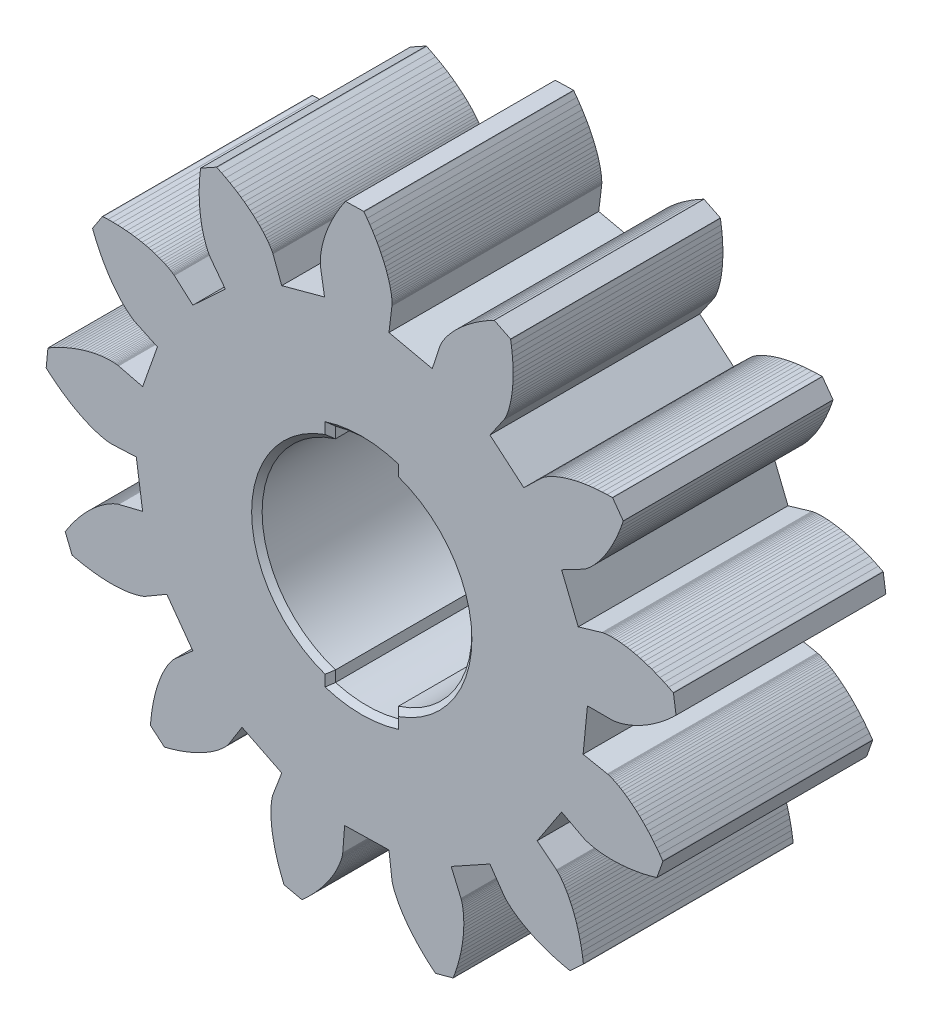
from build123d import *

# Parameters (mm, degrees)
BOSS_EXTRUDE1_DEPTH = 5
CHAMFER1_SIZE       = 0.25


with BuildPart() as part:
    # Model → Boss-Extrude1 (new, symmetric)
    with BuildSketch(Plane.XY):
        Polygon((10.551307782, -2.104276688), (10.759088916, 0), (11.943493667, 2.011e-05), (11.953388007, 0.000341878), (11.971869507, 0.001437897), (11.998887892, 0.003740543), (12.034392886, 0.007732467), (12.078304046, 0.013866153), (12.130530876, 0.022594087), (12.190952712, 0.034358698), (12.259448893, 0.049602416), (12.335858535, 0.068787783), (12.420010699, 0.09232706), (12.511734446, 0.120662679), (12.610808561, 0.154196849), (12.717041995, 0.193371999), (12.830163257, 0.238570228), (12.949951132, 0.290193744), (13.076114018, 0.348634702), (13.208380425, 0.414275199), (13.346438641, 0.48746717), (13.489987009, 0.568572601), (13.638673595, 0.65793337), (13.792176634, 0.755891355), (13.950124081, 0.862758268), (14.112143894, 0.978845821), (14.277843919, 1.10443556), (14.446832001, 1.239809031), (14.618705933, 1.385237726), (14.793033339, 1.540962969), (14.969381845, 1.707205975), (14.980452646, 1.717955009), (14.98425352, 1.721655331), (14.85881461, 2.583277359), (14.855395834, 2.585077244), (14.841730785, 2.592246618), (14.625593761, 2.701898828), (14.414373741, 2.802008631), (14.208412602, 2.892948071), (14.008052223, 2.975048969), (13.81361437, 3.04870348), (13.625400701, 3.114273591), (13.443692761, 3.172151456), (13.268772096, 3.222749339), (13.100890088, 3.266459395), (12.940278007, 3.303693887), (12.787157067, 3.334895245), (12.641738427, 3.360475733), (12.504203083, 3.380887836), (12.374711918, 3.396563929), (12.253415759, 3.407956497), (12.140455381, 3.41550797), (12.035931335, 3.419690943), (11.939944173, 3.420947846), (11.852564283, 3.419751274), (11.773851995, 3.416553713), (11.703847531, 3.411837813), (11.642560945, 3.406046005), (11.590002293, 3.399660938), (11.546141409, 3.393125043), (11.510958182, 3.386931025), (11.484382227, 3.38151126), (11.466353212, 3.377328287), (11.456760529, 3.374844647), (10.32062085, 3.040186705), (9.52670064, 5), (10.575430263, 5.550432978), (10.584037534, 5.555319816), (10.599894621, 5.564872279), (10.622750144, 5.579472463), (10.652332611, 5.599512523), (10.688370531, 5.625344391), (10.730552193, 5.657340112), (10.778585994, 5.695841562), (10.832150169, 5.741170508), (10.890892783, 5.793668829), (10.954461905, 5.85361807), (11.022515656, 5.921329944), (11.094661883, 5.997075941), (11.170518488, 6.081117497), (11.24968326, 6.173716049), (11.331753993, 6.27509281), (11.416308366, 6.385479051), (11.502914004, 6.505055766), (11.591148588, 6.63402406), (11.680559634, 6.772554871), (11.770694655, 6.920788973), (11.861081057, 7.078857083), (11.95127641, 7.246879864), (12.040788008, 7.424957869), (12.129143255, 7.613171538), (12.215869556, 7.811581204), (12.300474204, 8.020217032), (12.382464495, 8.239119243), (12.461347722, 8.468277782), (12.466164174, 8.482938297), (12.467803175, 8.487986019), (11.956324132, 9.192615846), (11.952462926, 9.192615846), (11.937028159, 9.192625901), (11.694687222, 9.189267457), (11.461134551, 9.179755216), (11.236510918, 9.164561773), (11.020936986, 9.14414967), (10.814543473, 9.119001557), (10.617420875, 9.089590028), (10.429629525, 9.056397736), (10.251229754, 9.019907331), (10.082261782, 8.980591408), (9.922735664, 8.938922563), (9.772661457, 8.895393501), (9.632008993, 8.850466763), (9.500738053, 8.804614945), (9.378798361, 8.758320697), (9.266109473, 8.71204656), (9.162570839, 8.666234962), (9.068081906, 8.621358501), (8.9825019, 8.57786966), (8.90569005, 8.536200815), (8.837475415, 8.496794395), (8.777677002, 8.460082775), (8.726103762, 8.426468163), (8.682534479, 8.396382935), (8.646737884, 8.370229299), (8.618462597, 8.348379299), (8.59744718, 8.331235143), (8.583430199, 8.31915882), (8.576089886, 8.312502262), (7.725609045, 7.488185113), (6.111856315, 8.854559239), (6.78466136, 9.829312585), (6.790010739, 9.83763831), (6.799613477, 9.853465231), (6.813067366, 9.877014564), (6.829950086, 9.908507523), (6.849849373, 9.948125103), (6.872332852, 9.996068408), (6.896978204, 10.05247821), (6.923332945, 10.117505339), (6.950954643, 10.191280513), (6.979390814, 10.273914338), (7.008168863, 10.365497311), (7.036856415, 10.466089765), (7.064960765, 10.575762085), (7.092029426, 10.694544438), (7.117579748, 10.822446878), (7.141159247, 10.959479461), (7.162275215, 11.105612021), (7.180465114, 11.260814393), (7.195256348, 11.425026244), (7.20617632, 11.598167134), (7.212762492, 11.78013651), (7.214532211, 11.970833819), (7.211032993, 12.170108234), (7.201802298, 12.377829037), (7.186397696, 12.593805178), (7.164346591, 12.817865719), (7.13521661, 13.049789444), (7.098565321, 13.289365194), (7.096021349, 13.304588802), (7.095126434, 13.309807463), (6.314780776, 13.696028589), (6.311351945, 13.694238759), (6.297686896, 13.687069385), (6.084666991, 13.571484593), (5.882285512, 13.454522236), (5.690451962, 13.336675019), (5.509065789, 13.218425593), (5.337996276, 13.100246554), (5.177112703, 12.982590386), (5.026254188, 12.865929686), (4.885249792, 12.750716937), (4.753908465, 12.637374461), (4.632029104, 12.52635474), (4.519370382, 12.418059985), (4.41570103, 12.312912516), (4.320779722, 12.211314539), (4.234314857, 12.113658211), (4.156044999, 12.020305518), (4.085658436, 11.931628504), (4.022843456, 11.847979101), (3.967278292, 11.769699188), (3.918621067, 11.697110531), (3.876539957, 11.630514787), (3.840652866, 11.570223668), (3.810607858, 11.51649861), (3.786002727, 11.469611104), (3.766465428, 11.429802475), (3.751583698, 11.397324104), (3.740945271, 11.372377095), (3.734137885, 11.355162553), (3.73073922, 11.345861471), (3.360757279, 10.220732262), (1.296862368, 10.680638064), (1.439606318, 11.856415434), (1.440481122, 11.866279608), (1.441627418, 11.884751053), (1.442592719, 11.91184988), (1.442904431, 11.947586143), (1.442110068, 11.991919623), (1.439747091, 12.044810097), (1.435352958, 12.10620729), (1.42846513, 12.176040816), (1.418641177, 12.254200067), (1.405408504, 12.34058449), (1.38834479, 12.435053313), (1.366987495, 12.537455707), (1.340914301, 12.647620733), (1.309672723, 12.765377453), (1.27286055, 12.890504652), (1.230055465, 13.022801224), (1.180845202, 13.162015791), (1.124827553, 13.307886915), (1.061610364, 13.460163216), (0.990821592, 13.618543038), (0.912079139, 13.782724724), (0.825031071, 13.952406617), (0.729325455, 14.127236784), (0.624620415, 14.306863293), (0.510604238, 14.490944266), (0.386955158, 14.679087549), (0.253381572, 14.870911043), (0.109591879, 15.066012541), (0.100260631, 15.078310079), (0.09704296, 15.082523218), (-0.773407554, 15.061859734), (-0.775599593, 15.058682283), (-0.784377803, 15.045982536), (-0.919278679, 14.844636745), (-1.044124331, 14.647021442), (-1.159216417, 14.45352878), (-1.264876703, 14.264520748), (-1.361426957, 14.080379444), (-1.449209056, 13.90143669), (-1.528564878, 13.728034365), (-1.599876522, 13.560484179), (-1.663505975, 13.399097845), (-1.719835336, 13.244146855), (-1.769256758, 13.095902698), (-1.812182506, 12.95462681), (-1.849024844, 12.820550463), (-1.880196037, 12.693894871), (-1.906118402, 12.574861137), (-1.927234371, 12.463630257), (-1.943986373, 12.360373169), (-1.956806783, 12.265240702), (-1.966148085, 12.178353518), (-1.972462766, 12.099832279), (-1.976213364, 12.029757428), (-1.977852365, 11.968229517), (-1.977852365, 11.915278711), (-1.976655794, 11.870955286), (-1.974735246, 11.835279354), (-1.972563318, 11.808240859), (-1.970592494, 11.7898398), (-1.96927526, 11.780025902), (-1.774002824, 10.611830171), (-3.815223206, 10.059919076), (-4.235239938, 11.167351092), (-4.239050867, 11.17649129), (-4.24662245, 11.193384065), (-4.258366951, 11.217828313), (-4.274686579, 11.249612874), (-4.295993597, 11.288496422), (-4.322670104, 11.334237633), (-4.355098199, 11.386565015), (-4.39363987, 11.445186967), (-4.43866716, 11.509831997), (-4.490521947, 11.580168284), (-4.549536052, 11.655884116), (-4.616041299, 11.736637614), (-4.690329288, 11.822066791), (-4.772701678, 11.911819714), (-4.863450068, 12.005504229), (-4.962835895, 12.102748294), (-5.071110539, 12.203149698), (-5.188495216, 12.306286123), (-5.315241305, 12.41173525), (-5.451519746, 12.519074759), (-5.597551754, 12.627862219), (-5.753478102, 12.737655202), (-5.919469728, 12.847971057), (-6.09565735, 12.958377409), (-6.282161632, 13.068381551), (-6.479083125, 13.177520945), (-6.68650227, 13.285292828), (-6.904479401, 13.391224606), (-6.918456161, 13.397770556), (-6.923262558, 13.400012871), (-7.684412795, 12.977190731), (-7.684885391, 12.973359691), (-7.686745607, 12.958035531), (-7.712627752, 12.717062105), (-7.731330467, 12.484062471), (-7.743326348, 12.259247789), (-7.74904777, 12.042788997), (-7.748967329, 11.83486709), (-7.743527453, 11.635632896), (-7.733220849, 11.445207077), (-7.718489947, 11.263720352), (-7.699827452, 11.091243107), (-7.677695906, 10.927855784), (-7.652567903, 10.773628769), (-7.624926094, 10.628592229), (-7.59523302, 10.492746162), (-7.563971331, 10.366120735), (-7.531613622, 10.248665672), (-7.498622434, 10.140370917), (-7.465470363, 10.041156029), (-7.432609894, 9.950960676), (-7.400503566, 9.869684306), (-7.369603864, 9.797216312), (-7.340363275, 9.733436031), (-7.313214172, 9.678182579), (-7.288609041, 9.631305128), (-7.26695009, 9.592612629), (-7.248669694, 9.561914032), (-7.234180117, 9.538988123), (-7.223883569, 9.523603631), (-7.218162147, 9.515529287), (-6.502371022, 8.571886802), (-8.053298717, 7.134593186), (-8.939847643, 7.919986566), (-8.947469503, 7.926301246), (-8.962019411, 7.937744091), (-8.983778914, 7.953933), (-9.012999393, 7.974485876), (-9.049942283, 7.999020621), (-9.094818745, 8.02712497), (-9.147839937, 8.05838666), (-9.209227075, 8.092383369), (-9.279130987, 8.128692781), (-9.357732668, 8.166882519), (-9.44517289, 8.206500099), (-9.54158237, 8.247093035), (-9.647071718, 8.288218898), (-9.761721374, 8.329405093), (-9.88561178, 8.370189078), (-10.018803268, 8.410108315), (-10.161326002, 8.448690207), (-10.313200095, 8.485452103), (-10.4744356, 8.519931464), (-10.644992298, 8.551645638), (-10.824840021, 8.580111975), (-11.013928495, 8.604857879), (-11.212177278, 8.625400701), (-11.419495871, 8.641277898), (-11.635763614, 8.652016877), (-11.860839732, 8.657134985), (-12.094583452, 8.656169684), (-12.336833892, 8.648668487), (-12.352248549, 8.647974677), (-12.357547652, 8.647713241), (-12.835009874, 7.919614523), (-12.833642364, 7.915994643), (-12.828182378, 7.901565397), (-12.739103155, 7.676167512), (-12.647389463, 7.461156672), (-12.553534009, 7.256522823), (-12.458009388, 7.062195578), (-12.361308305, 6.878134716), (-12.263903357, 6.704239684), (-12.166277194, 6.540430042), (-12.068892357, 6.386565015), (-11.972211385, 6.242513886), (-11.876686764, 6.108135882), (-11.782770978, 5.983250009), (-11.690886348, 5.867665217), (-11.601475302, 5.761190458), (-11.514940051, 5.663584406), (-11.431702912, 5.574625845), (-11.352166096, 5.494063396), (-11.276701645, 5.421625568), (-11.205681603, 5.357030813), (-11.139488068, 5.299987532), (-11.078452863, 5.250173955), (-11.022917865, 5.207288428), (-10.973204841, 5.170979017), (-10.929625503, 5.140913899), (-10.892471453, 5.116710977), (-10.862024237, 5.098028372), (-10.838535236, 5.084463876), (-10.822265884, 5.075625334), (-10.813447453, 5.07113065), (-9.741118221, 4.568228712), (-10.446451914, 2.574820916), (-11.596437635, 2.858247495), (-11.606130871, 2.860298761), (-11.624330825, 2.863667261), (-11.65111794, 2.867890454), (-11.686552547, 2.872505802), (-11.730654756, 2.877060818), (-11.783444678, 2.881092963), (-11.844932369, 2.88412964), (-11.915077606, 2.88570831), (-11.993860281, 2.885376488), (-12.08119995, 2.882661577), (-12.177036283, 2.877101039), (-12.281268728, 2.868242387), (-12.393776621, 2.855633137), (-12.514439301, 2.838820804), (-12.643095883, 2.817362957), (-12.779585483, 2.790817168), (-12.923706999, 2.758741006), (-13.075279435, 2.720712151), (-13.234061466, 2.67631834), (-13.399821821, 2.625127199), (-13.572299066, 2.566756627), (-13.751231765, 2.500794363), (-13.93631826, 2.426858306), (-14.12726695, 2.344566358), (-14.323746013, 2.253566588), (-14.525423627, 2.153497006), (-14.731947858, 2.04402579), (-14.942956718, 1.924801007), (-14.956289944, 1.917018264), (-14.960855016, 1.91433352), (-15.045268615, 1.047744211), (-15.042372711, 1.045170074), (-15.030829315, 1.034933857), (-14.847210882, 0.876755139), (-14.666086145, 0.728993633), (-14.487867368, 0.591418068), (-14.312986924, 0.463746898), (-14.141816858, 0.345698577), (-13.974769434, 0.236991558), (-13.812196584, 0.137304074), (-13.654460296, 0.046324414), (-13.501912503, -0.036289301), (-13.354885029, -0.110889002), (-13.213679528, -0.177816569), (-13.078607714, -0.237464153), (-12.949951132, -0.290193744), (-12.827971218, -0.33640755), (-12.712929408, -0.37648767), (-12.605056973, -0.410856423), (-12.504575127, -0.439936129), (-12.411674919, -0.464128996), (-12.326547398, -0.483877455), (-12.249363504, -0.499613879), (-12.180253955, -0.5117807), (-12.119369578, -0.520830401), (-12.06680087, -0.527205412), (-12.02265844, -0.531358219), (-11.987012674, -0.533751362), (-11.959913847, -0.534857437), (-11.941402181, -0.535108818), (-11.931507841, -0.53499821), (-10.748289607, -0.481956907), (-10.446451914, -2.574820916), (-11.59642758, -2.858287716), (-11.605959932, -2.860972461), (-11.62364707, -2.866442502), (-11.64932811, -2.875160381), (-11.682842169, -2.887528305), (-11.724018309, -2.903988706), (-11.772635313, -2.924963902), (-11.828492078, -2.950846046), (-11.891337224, -2.982047404), (-11.96093948, -3.018950074), (-12.037007244, -3.061946209), (-12.119289136, -3.111407852), (-12.207463389, -3.167686937), (-12.301228346, -3.231135396), (-12.400252185, -3.302095106), (-12.504203083, -3.380887836), (-12.612708998, -3.467825297), (-12.725428051, -3.563209145), (-12.841958034, -3.667310871), (-12.961926903, -3.780412023), (-13.084912339, -3.90276398), (-13.210502077, -4.034618123), (-13.338283855, -4.176175556), (-13.467815241, -4.327657495), (-13.598643751, -4.489254988), (-13.730326956, -4.661138975), (-13.862402314, -4.843470339), (-13.99439723, -5.036389853), (-14.125829053, -5.240008125), (-14.134014005, -5.25308997), (-14.136819412, -5.25759471), (-13.808828084, -6.064154336), (-13.805077486, -6.065089471), (-13.790095203, -6.068779738), (-13.55399856, -6.123520374), (-13.324950629, -6.17017661), (-13.103212845, -6.209180821), (-12.889026534, -6.240955327), (-12.68261291, -6.265932501), (-12.484173079, -6.284554775), (-12.293898088, -6.297264577), (-12.111948823, -6.304524448), (-11.938486166, -6.306786874), (-11.77363078, -6.304504338), (-11.617493273, -6.298159492), (-11.470174197, -6.288194766), (-11.331753993, -6.27509281), (-11.202272883, -6.25932622), (-11.081781142, -6.241357536), (-10.970288826, -6.221659353), (-10.86780599, -6.200704268), (-10.774302469, -6.17895482), (-10.689748097, -6.156883605), (-10.614092597, -6.134943108), (-10.547245472, -6.113605924), (-10.489126282, -6.093324538), (-10.439624417, -6.074541381), (-10.398599106, -6.057698882), (-10.365919631, -6.043259582), (-10.341415051, -6.031635744), (-10.32491443, -6.023269798), (-10.316196551, -6.018563953), (-9.293158024, -5.421736175), (-8.053298717, -7.134593186), (-8.939817478, -7.920016732), (-8.947006962, -7.926824118), (-8.960118973, -7.939885853), (-8.978811633, -7.959533759), (-9.002743065, -7.986069494), (-9.03155128, -8.019774602), (-9.064854179, -8.060940686), (-9.10227972, -8.109819127), (-9.143435749, -8.166651249), (-9.187910002, -8.231668322), (-9.235290214, -8.305101618), (-9.285154066, -8.387122074), (-9.337079239, -8.477940851), (-9.390613248, -8.577698721), (-9.445313663, -8.686546513), (-9.500738053, -8.804614945), (-9.55642388, -8.93202468), (-9.611898547, -9.068866213), (-9.666709569, -9.215199878), (-9.72036424, -9.37109606), (-9.772400021, -9.53659498), (-9.822344315, -9.711696638), (-9.869694361, -9.8964312), (-9.913997675, -10.090758445), (-9.95474144, -10.294638153), (-9.991463115, -10.508040157), (-10.023680051, -10.730863905), (-10.05089954, -10.9630189), (-10.072648988, -11.204394535), (-10.073815394, -11.219789082), (-10.074207548, -11.225078129), (-9.408953975, -11.786823233), (-9.405203377, -11.785908208), (-9.390221094, -11.782217941), (-9.155723232, -11.720961521), (-8.931230317, -11.655833839), (-8.716772515, -11.587327603), (-8.51235988, -11.515915407), (-8.317972304, -11.442110068), (-8.133609785, -11.366384182), (-7.959222047, -11.289210343), (-7.794738705, -11.211081258), (-7.640089371, -11.132469523), (-7.495183548, -11.053837677), (-7.359880464, -10.975658315), (-7.23406951, -10.898373869), (-7.117579748, -10.822446878), (-7.01026035, -10.748319772), (-6.911920266, -10.67641487), (-6.822358392, -10.607154492), (-6.741353513, -10.540971013), (-6.668664304, -10.47826664), (-6.604059495, -10.419423474), (-6.547257538, -10.364843722), (-6.497986944, -10.314879317), (-6.455956111, -10.269912359), (-6.420853326, -10.230274668), (-6.392346768, -10.196298069), (-6.370124725, -10.168324438), (-6.353825208, -10.146645376), (-6.34310634, -10.131562541), (-6.337575967, -10.123347424), (-5.709084291, -9.119454042), (-3.815223206, -10.059919076), (-4.235199717, -11.167371203), (-4.238407333, -11.176732616), (-4.243937706, -11.194399643), (-4.251368516, -11.220482892), (-4.260217112, -11.255092971), (-4.270061176, -11.298330431), (-4.280428111, -11.350255604), (-4.290855378, -11.410928821), (-4.300880435, -11.480370193), (-4.310040744, -11.558619941), (-4.317873763, -11.645647898), (-4.323906897, -11.741454066), (-4.327677605, -11.845998222), (-4.328723349, -11.959209981), (-4.326571531, -12.081008901), (-4.320779722, -12.211314539), (-4.310875327, -12.350006234), (-4.296405861, -12.496953267), (-4.276928893, -12.651994755), (-4.25199194, -12.814969814), (-4.221162625, -12.98569745), (-4.18399852, -13.163956449), (-4.14008736, -13.349525595), (-4.08899677, -13.542183673), (-4.030324542, -13.741649137), (-3.963678522, -13.947670607), (-3.888646446, -14.159936371), (-3.804856271, -14.378154826), (-3.711946007, -14.601994152), (-3.705822376, -14.616161961), (-3.70371078, -14.62102869), (-2.853612037, -14.809272525), (-2.850716133, -14.806718498), (-2.839152626, -14.796492336), (-2.659988658, -14.633275952), (-2.491483226, -14.471286304), (-2.333425171, -14.310955769), (-2.185603334, -14.152726775), (-2.047786443, -13.997041753), (-1.919733175, -13.844302912), (-1.801182092, -13.69493257), (-1.691851649, -13.549322881), (-1.591450245, -13.40784589), (-1.499676222, -13.270873638), (-1.416207813, -13.138768114), (-1.340723252, -13.011871197), (-1.27286055, -12.890504652), (-1.212287885, -12.774990246), (-1.158633214, -12.665619583), (-1.111504382, -12.562684262), (-1.070539402, -12.466435665), (-1.035315955, -12.377125171), (-1.005451942, -12.295004163), (-0.980525044, -12.220273743), (-0.960122995, -12.153135018), (-0.943803368, -12.093779034), (-0.931133787, -12.042366678), (-0.921691932, -11.999048776), (-0.915005209, -11.963945991), (-0.910651297, -11.937178987), (-0.908167657, -11.91883826), (-0.907091748, -11.908994196), (-0.81711761, -10.728018276), (1.296862368, -10.680638064), (1.439646539, -11.856405378), (1.441164878, -11.866189111), (1.444473046, -11.884409175), (1.450023529, -11.910954965), (1.458268812, -11.945715872), (1.46964127, -11.988571233), (1.484603442, -12.039370221), (1.503557538, -12.097931842), (1.526956043, -12.164085156), (1.55521122, -12.237619004), (1.588725279, -12.318322226), (1.627900429, -12.405963552), (1.673138879, -12.500281546), (1.724832782, -12.601004718), (1.783334071, -12.707861576), (1.849024844, -12.820550463), (1.92224698, -12.938749613), (2.003342356, -13.062137258), (2.092642794, -13.19037152), (2.190460006, -13.323090413), (2.297105705, -13.459931946), (2.41285138, -13.600503968), (2.537968523, -13.744414323), (2.672738681, -13.891260804), (2.817383068, -14.040621091), (2.972143009, -14.192062809), (3.137229665, -14.345143528), (3.31282403, -14.499430874), (3.499117151, -14.654452252), (3.511123088, -14.664155542), (3.515255785, -14.667473766), (4.355470243, -14.439099535), (4.356847808, -14.435489709), (4.362327905, -14.421060464), (4.445112558, -14.193279491), (4.519048615, -13.971531652), (4.584488008, -13.756118603), (4.641843002, -13.547321892), (4.69152586, -13.345423063), (4.733928737, -13.150673499), (4.769484006, -12.963314523), (4.798624043, -12.783567352), (4.821771167, -12.611643144), (4.839387918, -12.447712839), (4.851896616, -12.291947375), (4.859769856, -12.144507636), (4.863450068, -12.005504229), (4.863409847, -11.875077928), (4.860091623, -11.753299119), (4.853978047, -11.640248243), (4.84553166, -11.535975578), (4.835204946, -11.440541454), (4.82349061, -11.353945871), (4.810831084, -11.276188829), (4.797698963, -11.207260273), (4.784566841, -11.147119983), (4.771887205, -11.095707626), (4.760122593, -11.052962872), (4.749725492, -11.018775113), (4.741138332, -10.993053852), (4.734823651, -10.975658315), (4.731193716, -10.966437676), (4.262037108, -9.878915001), (6.111856315, -8.854559239), (6.784691526, -9.829292474), (6.790583887, -9.837246156), (6.801976455, -9.851836285), (6.819231218, -9.872761205), (6.842679999, -9.899719258), (6.87267473, -9.932378623), (6.909517068, -9.970397423), (6.95352878, -10.013443834), (7.004981358, -10.061145813), (7.064176457, -10.113131317), (7.131355404, -10.169018248), (7.206769579, -10.228414452), (7.290660306, -10.29089761), (7.383238747, -10.356065512), (7.484706005, -10.423495839), (7.59523302, -10.492746162), (7.715000784, -10.563384106), (7.844150072, -10.63494713), (7.982821657, -10.706992804), (8.131106034, -10.77905859), (8.289123868, -10.850661835), (8.45693549, -10.921339999), (8.634611285, -10.990620488), (8.82218142, -11.058010594), (9.019676061, -11.123047778), (9.227085152, -11.185219224), (9.444398637, -11.244052335), (9.671586352, -11.299064462), (9.90857791, -11.349752843), (9.923721076, -11.352759354), (9.928919627, -11.353784987), (10.566762661, -10.761099961), (10.56630012, -10.757268921), (10.564449959, -10.741944761), (10.531901201, -10.501775752), (10.494304722, -10.271068709), (10.452153226, -10.049914128), (10.405909254, -9.838382396), (10.356065512, -9.636523789), (10.303104651, -9.444378527), (10.247519376, -9.261956666), (10.18979234, -9.089258206), (10.130396136, -8.926263037), (10.06980336, -8.772920881), (10.008496664, -8.62919152), (9.946948642, -8.494974399), (9.88561178, -8.370189078), (9.824958673, -8.254714894), (9.765431751, -8.148431184), (9.707473444, -8.051167009), (9.651536237, -7.962771541), (9.598052504, -7.883063786), (9.547424455, -7.811832585), (9.500084464, -7.748866776), (9.456424684, -7.693935092), (9.416847326, -7.64678615), (9.381734486, -7.607158515), (9.351448153, -7.57477064), (9.326350316, -7.549340981), (9.306802962, -7.530547768), (9.293117803, -7.518079291), (9.285626662, -7.511603728), (8.364809534, -6.766682621), (9.52670064, -5), (10.575450373, -5.550402812), (10.584359301, -5.554706448), (10.601231966, -5.562338362), (10.626229251, -5.572846071), (10.659522095, -5.585807253), (10.701251272, -5.600789536), (10.751547499, -5.617340434), (10.810521383, -5.634997406), (10.878253367, -5.653328078), (10.954823893, -5.671849799), (11.040283236, -5.690110085), (11.134661561, -5.707656449), (11.237978981, -5.723996187), (11.350245549, -5.738676813), (11.471421044, -5.751235787), (11.601475302, -5.761190458), (11.740347991, -5.768068231), (11.887958669, -5.771426675), (12.044226894, -5.770773086), (12.209011893, -5.765665032), (12.382213114, -5.75562992), (12.563649563, -5.740235373), (12.753160357, -5.719008796), (12.950574555, -5.691517816), (13.15566089, -5.657320001), (13.368208199, -5.615982979), (13.58797516, -5.567084428), (13.814700334, -5.510212085), (14.048102177, -5.444953686), (14.062913521, -5.440589719), (14.067991409, -5.439081435), (14.357340514, -4.617861294), (14.355148475, -4.614683844), (14.346380321, -4.601974041), (14.205959128, -4.40443918), (14.065457493, -4.217633242), (13.925348011, -4.041405398), (13.786093224, -3.875584711), (13.648155671, -3.720020352), (13.511967727, -3.574491105), (13.377971821, -3.438795867), (13.246600329, -3.312703367), (13.118255459, -3.195982335), (12.993349475, -3.088371335), (12.872264477, -2.989588822), (12.755392616, -2.899353248), (12.643095883, -2.817362957), (12.535726208, -2.743306238), (12.433615416, -2.676851267), (12.337105383, -2.617666223), (12.246497766, -2.565389117), (12.162094221, -2.519668017), (12.084166241, -2.480120824), (12.012985315, -2.446375494), (11.948802825, -2.418019765), (11.891839985, -2.394661481), (11.842328066, -2.375898434), (11.800468171, -2.361288195), (11.76643124, -2.350428554), (11.740378157, -2.342887136), (11.722469804, -2.338201402), (11.712826845, -2.335949032), align=None)
        with BuildLine():
            ThreePointArc((1.5, -5.291502622), (0, -5.5), (-1.5, -5.291502622))
            Line((-1.5, -5.291502622), (-1.5, -4.769696007))
            ThreePointArc((-1.5, -4.769696007), (-5, 0), (-1.5, 4.769696007))
            Line((-1.5, 4.769696007), (-1.5, 5.291502622))
            ThreePointArc((-1.5, 5.291502622), (0, 5.5), (1.5, 5.291502622))
            Line((1.5, 5.291502622), (1.5, 4.769696007))
            ThreePointArc((1.5, 4.769696007), (4.031128874, 2.958039892), (5, 0))
            ThreePointArc((5, 0), (4.031128874, -2.958039892), (1.5, -4.769696007))
            Line((1.5, -4.769696007), (1.5, -5.291502622))
        make_face(mode=Mode.SUBTRACT)
    extrude(amount=BOSS_EXTRUDE1_DEPTH, both=True)

    # Chamfer1
    chamfer1_edges = [part.edges().sort_by_distance(p)[0] for p in [
        (1.5, -5.030599315, -5),
        (5, 0, -5),
        (1.5, 5.030599315, -5),
        (0, 5.5, -5),
        (-1.5, 5.030599315, -5),
        (-5, 0, -5),
        (0, -5.5, -5),
        (-1.5, -5.030599315, -5),
        (1.5, -5.030599315, 5),
        (0, -5.5, 5),
        (-1.5, -5.030599315, 5),
        (5, 0, 5),
        (1.5, 5.030599315, 5),
        (0, 5.5, 5),
        (-1.5, 5.030599315, 5),
        (-5, 0, 5),
    ]]
    chamfer(chamfer1_edges, length=CHAMFER1_SIZE)


solid = part.part
